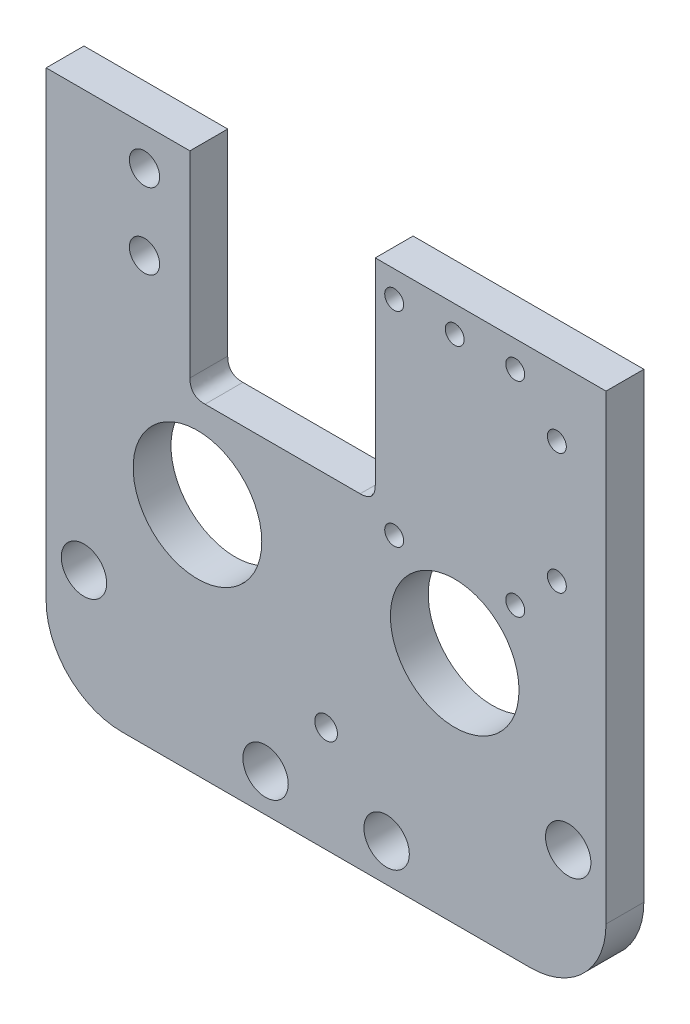
from build123d import *

# Parameters (mm, degrees)
SZKIC1_W                    = 54
SZKIC1_H                    = 71
DODANIE_WYCI_GNI_CIE1_DEPTH = 5
SZKIC2_W                    = 23.5
SZKIC2_H                    = 28
WYTNIJ_WYCI_GNI_CIE1_DEPTH  = 5
SZKIC3_W                    = 21
SZKIC3_H                    = 21
WYTNIJ_WYCI_GNI_CIE2_DEPTH  = 3
SZKIC4_R                    = 1.25
WYTNIJ_WYCI_GNI_CIE3_DEPTH  = 5
SZKIC5_W                    = 20
SZKIC5_H                    = 43
DODANIE_WYCI_GNI_CIE2_DEPTH = 5
SZKIC6_R                    = 8.5
WYTNIJ_WYCI_GNI_CIE4_DEPTH  = 5
SZKIC7_R                    = 3
WYTNIJ_WYCI_GNI_CIE5_DEPTH  = 10
ZAOKR_GLENIE3_R             = 10
SZKIC8_W                    = 19
SZKIC8_H                    = 28
DODANIE_WYCI_GNI_CIE3_DEPTH = 5
ZAOKR_GLENIE2_SIZE          = 2
SZKIC9_R                    = 2
WYTNIJ_WYCI_GNI_CIE6_DEPTH  = 10
SZKIC10_R                   = 1.5
WYTNIJ_WYCI_GNI_CIE7_DEPTH  = 10
ZAOKR_GLENIE4_R             = 2


with BuildPart() as part:
    # Szkic1 → Dodanie-wyciągnięcie1 (new body)
    with BuildSketch(Plane.XY):
        with Locations((7, 0.5)):
            Rectangle(SZKIC1_W, SZKIC1_H)
    extrude(amount=DODANIE_WYCI_GNI_CIE1_DEPTH)

    # Szkic2 → Wytnij-wyciągnięcie1 (cut)
    with BuildSketch(Plane.XY.offset(5)):
        with Locations((-8.25, 22)):
            Rectangle(SZKIC2_W, SZKIC2_H)
    extrude(amount=-WYTNIJ_WYCI_GNI_CIE1_DEPTH, mode=Mode.SUBTRACT)

    # Szkic3 → Wytnij-wyciągnięcie2 (cut)
    with BuildSketch(Plane(origin=(0, 0, 0), x_dir=(-1, 0, 0), z_dir=(0, 0, -1))):
        with Locations((-14, 20)):
            Rectangle(SZKIC3_W, SZKIC3_H)
    extrude(amount=-WYTNIJ_WYCI_GNI_CIE2_DEPTH, mode=Mode.SUBTRACT)

    # Szkic4 → Wytnij-wyciągnięcie3 (cut)
    with BuildSketch(Plane.XY.offset(5)):
        with Locations((6, 32.5)):
            Circle(SZKIC4_R)
        with Locations((14, 32.5)):
            Circle(SZKIC4_R)
        with Locations((22, 32.5)):
            Circle(SZKIC4_R)
        with Locations((22, 5.5)):
            Circle(SZKIC4_R)
        with Locations((6, 5.5)):
            Circle(SZKIC4_R)
        with Locations((27.5, 27)):
            Circle(SZKIC4_R)
        with Locations((27.5, 11)):
            Circle(SZKIC4_R)
    extrude(amount=-WYTNIJ_WYCI_GNI_CIE3_DEPTH, mode=Mode.SUBTRACT)

    # Szkic5 → Dodanie-wyciągnięcie2 (add)
    with BuildSketch(Plane.XY.offset(5)):
        with Locations((-30, -13.5)):
            Rectangle(SZKIC5_W, SZKIC5_H)
    extrude(amount=-DODANIE_WYCI_GNI_CIE2_DEPTH)

    # Szkic6 → Wytnij-wyciągnięcie4 (cut)
    with BuildSketch(Plane.XY.offset(5)):
        with Locations((-20, -4)):
            Circle(SZKIC6_R)
        with Locations((14, -4)):
            Circle(SZKIC6_R)
    extrude(amount=-WYTNIJ_WYCI_GNI_CIE4_DEPTH, mode=Mode.SUBTRACT)

    # Szkic7 → Wytnij-wyciągnięcie5 (cut)
    with BuildSketch(Plane.XY.offset(5)):
        with Locations((-11, -30)):
            Circle(SZKIC7_R)
        with Locations((5, -30)):
            Circle(SZKIC7_R)
        with Locations((-35, -19)):
            Circle(SZKIC7_R)
        with Locations((29, -19)):
            Circle(SZKIC7_R)
    extrude(amount=-WYTNIJ_WYCI_GNI_CIE5_DEPTH, mode=Mode.SUBTRACT)

    # Zaokrąglenie3
    zaokr_glenie3_edges = [part.edges().sort_by_distance(p)[0] for p in [
        (-40, -35, 2.5),
        (34, -35, 2.5),
    ]]
    fillet(zaokr_glenie3_edges, radius=ZAOKR_GLENIE3_R)

    # Szkic8 → Dodanie-wyciągnięcie3 (add)
    with BuildSketch(Plane.XY.offset(5)):
        with Locations((-30.5, 22)):
            Rectangle(SZKIC8_W, SZKIC8_H)
    extrude(amount=-DODANIE_WYCI_GNI_CIE3_DEPTH)

    # Zaokrąglenie2
    # a fillet whose section is not a circle: 2 mm, written as the material it adds along each edge
    with BuildSketch(Plane(origin=(3.5, 8, 5), x_dir=(0, 1, 0), z_dir=(0, 0, -1))) as zaokr_glenie2_piece_1_section:
        with BuildLine():
            Bezier((ZAOKR_GLENIE2_SIZE, 0), (0, 0), (0, -ZAOKR_GLENIE2_SIZE), weights=[1, 1, 1])
            Line((0, -ZAOKR_GLENIE2_SIZE), (0, 0))
            Line((0, 0), (ZAOKR_GLENIE2_SIZE, 0))
        make_face()
    zaokr_glenie2_piece_1 = extrude(amount=5, mode=Mode.PRIVATE)
    zaokr_glenie2_piece_1 = split(zaokr_glenie2_piece_1, bisect_by=Plane(origin=(3.5, 9.5, 5), z_dir=(0, 1, 0)), keep=Keep.TOP, mode=Mode.PRIVATE)
    zaokr_glenie2_piece_1 = split(zaokr_glenie2_piece_1, bisect_by=Plane(origin=(3.5, 8, 3), z_dir=(0, 0, 1)), keep=Keep.TOP, mode=Mode.PRIVATE)
    add(zaokr_glenie2_piece_1)
    with BuildSketch(Plane(origin=(3.5, 8, 5), x_dir=(0, 1, 0), z_dir=(0, 0, -1))) as zaokr_glenie2_piece_2_section:
        with BuildLine():
            Bezier((ZAOKR_GLENIE2_SIZE, 0), (0, 0), (0, -ZAOKR_GLENIE2_SIZE), weights=[1, 1, 1])
            Line((0, -ZAOKR_GLENIE2_SIZE), (0, 0))
            Line((0, 0), (ZAOKR_GLENIE2_SIZE, 0))
        make_face()
    zaokr_glenie2_piece_2 = extrude(amount=5, mode=Mode.PRIVATE)
    zaokr_glenie2_piece_2 = split(zaokr_glenie2_piece_2, bisect_by=Plane(origin=(3.5, 9.5, 5), z_dir=(0, -1, 0)), keep=Keep.TOP, mode=Mode.PRIVATE)
    zaokr_glenie2_piece_2 = split(zaokr_glenie2_piece_2, bisect_by=Plane(origin=(3.5, 8, 3), z_dir=(0, 0, 1)), keep=Keep.TOP, mode=Mode.PRIVATE)
    add(zaokr_glenie2_piece_2)
    with BuildSketch(Plane(origin=(3.5, 8, 5), x_dir=(0, 1, 0), z_dir=(0, 0, -1))) as zaokr_glenie2_piece_3_section:
        with BuildLine():
            Bezier((ZAOKR_GLENIE2_SIZE, 0), (0, 0), (0, -ZAOKR_GLENIE2_SIZE), weights=[1, 1, 1])
            Line((0, -ZAOKR_GLENIE2_SIZE), (0, 0))
            Line((0, 0), (ZAOKR_GLENIE2_SIZE, 0))
        make_face()
    zaokr_glenie2_piece_3 = extrude(amount=5, mode=Mode.PRIVATE)
    zaokr_glenie2_piece_3 = split(zaokr_glenie2_piece_3, bisect_by=Plane(origin=(3.5, 9.5, 5), z_dir=(0, -1, 0)), keep=Keep.TOP, mode=Mode.PRIVATE)
    zaokr_glenie2_piece_3 = split(zaokr_glenie2_piece_3, bisect_by=Plane(origin=(3.5, 8, 3), z_dir=(0, 0, -1)), keep=Keep.TOP, mode=Mode.PRIVATE)
    add(zaokr_glenie2_piece_3)
    with BuildSketch(Plane(origin=(-21, 8, 5), x_dir=(1, 0, 0), z_dir=(0, 0, -1))) as zaokr_glenie2_piece_4:
        with BuildLine():
            Bezier((ZAOKR_GLENIE2_SIZE, 0), (0, 0), (0, -ZAOKR_GLENIE2_SIZE), weights=[1, 1, 1])
            Line((0, -ZAOKR_GLENIE2_SIZE), (0, 0))
            Line((0, 0), (ZAOKR_GLENIE2_SIZE, 0))
        make_face()
    extrude(amount=5)

    # Szkic9 → Wytnij-wyciągnięcie6 (cut)
    with BuildSketch(Plane.XY.offset(5)):
        with Locations((-27, 31)):
            Circle(SZKIC9_R)
        with Locations((-27, 21)):
            Circle(SZKIC9_R)
    extrude(amount=-WYTNIJ_WYCI_GNI_CIE6_DEPTH, mode=Mode.SUBTRACT)

    # Szkic10 → Wytnij-wyciągnięcie7 (cut)
    with BuildSketch(Plane.XY.offset(5)):
        with Locations((-3, -21)):
            Circle(SZKIC10_R)
    extrude(amount=-WYTNIJ_WYCI_GNI_CIE7_DEPTH, mode=Mode.SUBTRACT)

    # Zaokrąglenie4
    zaokr_glenie4_edges = [part.edges().sort_by_distance(p)[0] for p in [
        (24.5, 9.5, 1.5),
        (24.5, 30.5, 1.5),
    ]]
    fillet(zaokr_glenie4_edges, radius=ZAOKR_GLENIE4_R)


solid = part.part
